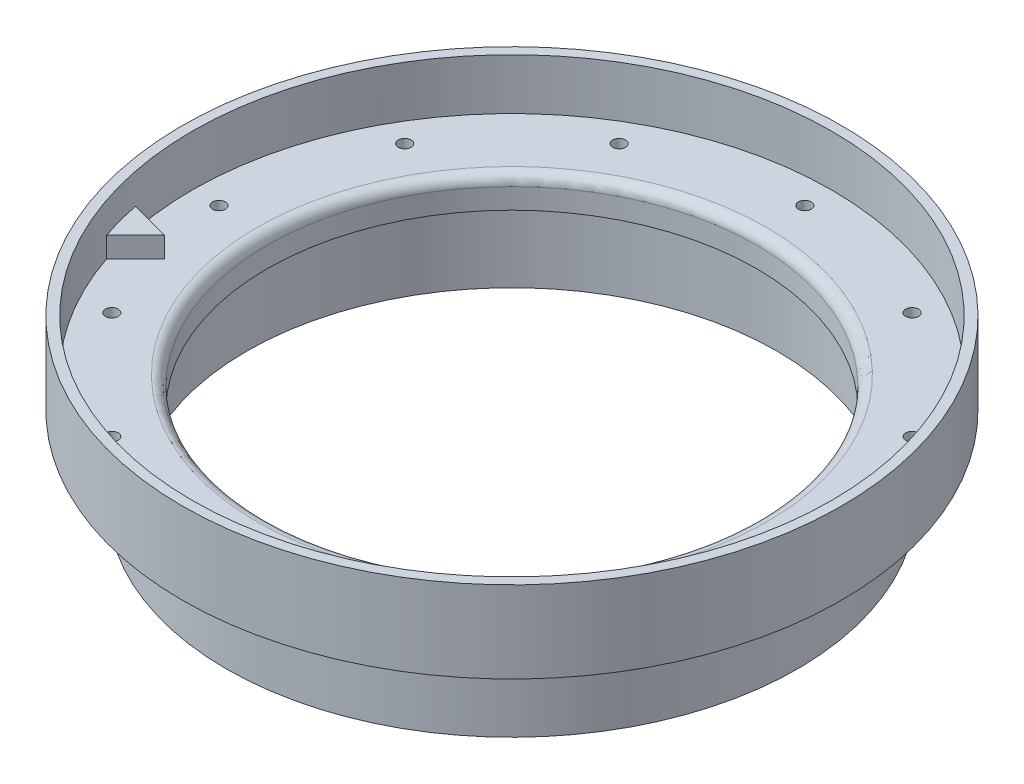
from build123d import *

# Parameters (mm, degrees)
F_3_48_TAPPED_HOLE1_D = 1.9939
CIRPATTERN1_COUNT     = 12
BOSS_EXTRUDE1_DEPTH   = 3.175


with BuildPart() as part:
    # Cross Section → Main (revolve)
    with BuildSketch(Plane.XY):
        with BuildLine():
            Line((-38.1, 0), (-38.1, -3.175))
            Line((-38.1, -3.175), (-41.275, -3.175))
            Line((-41.275, -3.175), (-41.275, -15.875))
            Line((-41.275, -15.875), (-44.45, -15.875))
            Line((-44.45, -15.875), (-44.45, -3.175))
            Line((-44.45, -3.175), (-51.308, -3.175))
            Line((-51.308, -3.175), (-51.308, 9.525))
            Line((-51.308, 9.525), (-49.784, 9.525))
            Line((-49.784, 9.525), (-49.784, 1.5875))
            Line((-49.784, 1.5875), (-39.6875, 1.5875))
            ThreePointArc((-39.6875, 1.5875), (-38.564967985, 1.122532015), (-38.1, 0))
        make_face()
    revolve(axis=Axis((0, 55, 0), (0, -1, 0)))

    # #3-48 Tapped Hole1 (through all)
    with Locations(Plane(origin=(0, 1.5875, 0), x_dir=(1, 0, 0), z_dir=(0, 1, 0))):
        with Locations((-45.6057, 0)):
            f_3_48_tapped_hole1 = Hole(F_3_48_TAPPED_HOLE1_D / 2)

    # CirPattern1: #3-48 Tapped Hole1 ×12 about axis
    cirpattern1_axis = Axis((0, 0, 0), (0, -1, 0))
    for i in range(1, CIRPATTERN1_COUNT):
        add(f_3_48_tapped_hole1.rotate(cirpattern1_axis, i * 360 / CIRPATTERN1_COUNT), mode=Mode.SUBTRACT)

    # Sketch3 → Boss-Extrude1 (add)
    with BuildSketch(Plane(origin=(0, 1.5875, 0), x_dir=(1, 0, 0), z_dir=(0, 1, 0))):
        with BuildLine():
            Line((-47.168007396, -15.925631363), (-42.677879335, -11.435503303))
            Line((-42.677879335, -11.435503303), (-48.811508332, -9.792002366))
            ThreePointArc((-48.811508332, -9.792002366), (-48.087651336, -12.885047341), (-47.168007396, -15.925631363))
        make_face()
    extrude(amount=BOSS_EXTRUDE1_DEPTH)


solid = part.part
